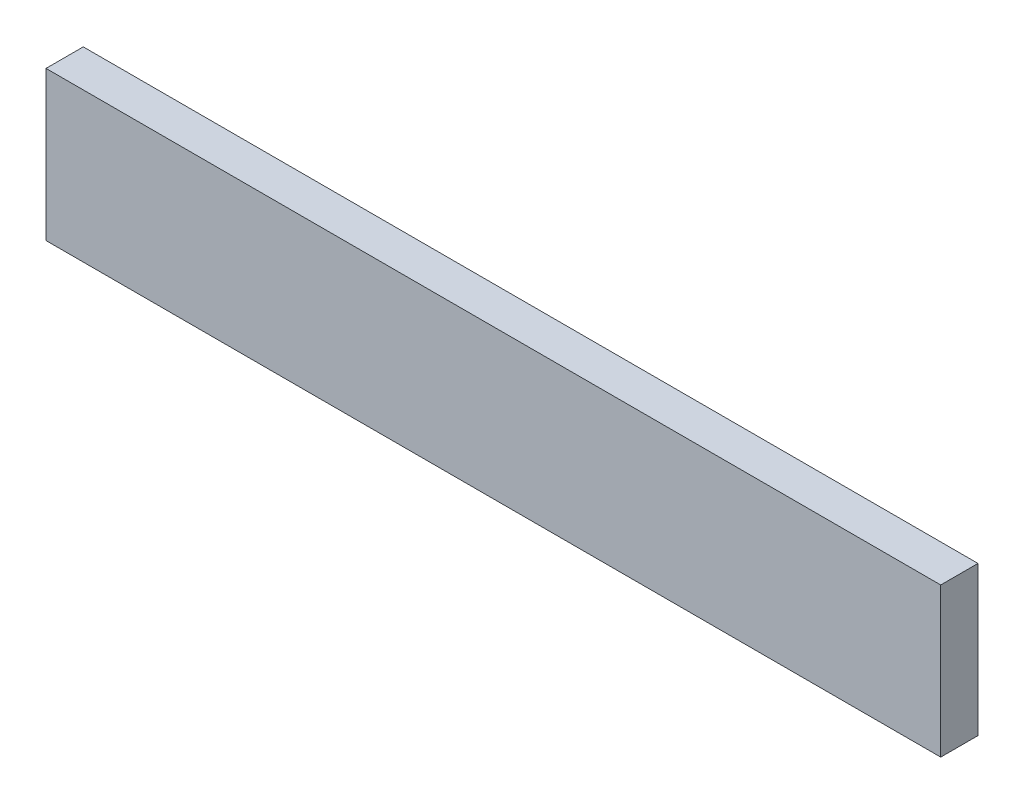
from build123d import *

# Parameters (mm, degrees)
SKETCH1_W           = 304.8
SKETCH1_H           = 50.8
BOSS_EXTRUDE1_DEPTH = 12.7


with BuildPart() as part:
    # Sketch1 → Boss-Extrude1 (new body)
    with BuildSketch(Plane.XY):
        Rectangle(SKETCH1_W, SKETCH1_H)
    extrude(amount=BOSS_EXTRUDE1_DEPTH)


solid = part.part
